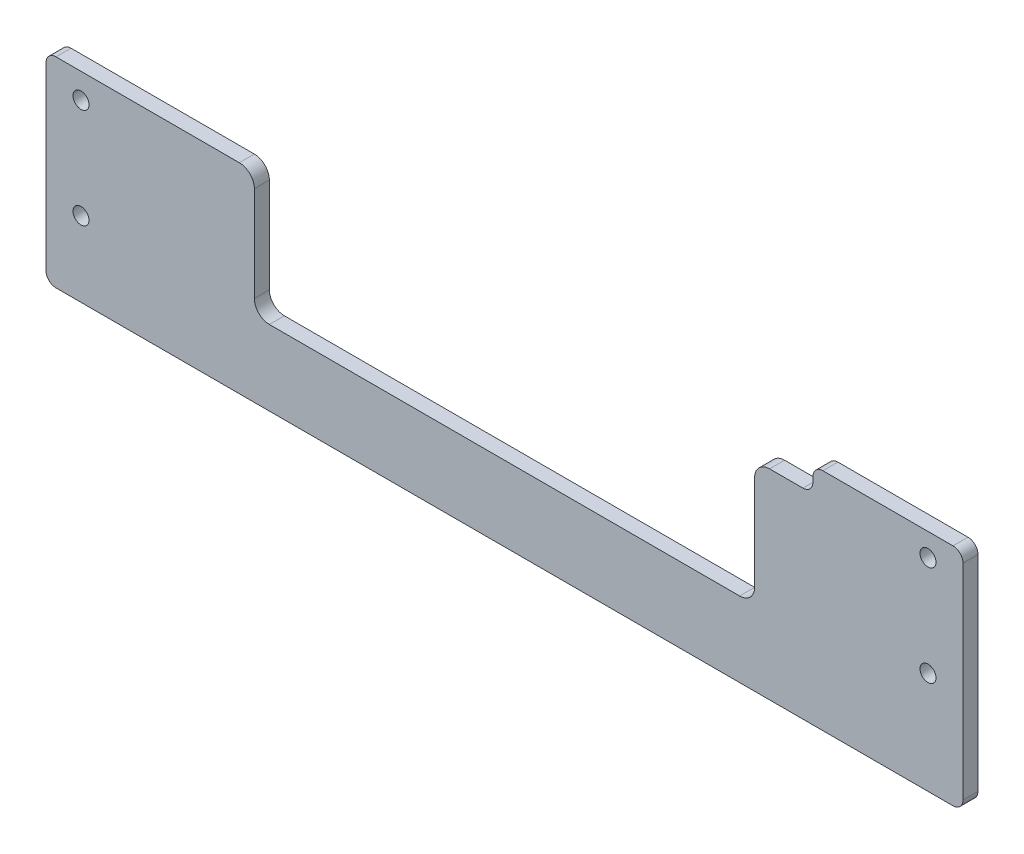
from build123d import *

# Parameters (mm, degrees)
EXTRUDE_1_DEPTH     = 3
FILLET_1_R          = 2
SKETCH_2_R          = 1.6
CUT_EXTRUDE_1_DEPTH = 14
SKETCH_3_W          = 100
SKETCH_3_H          = 25
CUT_EXTRUDE_2_DEPTH = 14
FILLET_2_R          = 3


with BuildPart() as part:
    # 草图1 → 凸台-拉伸1 (new body)
    with BuildSketch(Plane.XY):
        Polygon((0, 0), (183.3, 0), (183.3, 40), (183.3, 45), (153.3, 45), (153.3, 40), (0, 40), align=None)
    extrude(amount=EXTRUDE_1_DEPTH)

    # 圆角1
    fillet_1_edges = [part.edges().sort_by_distance(p)[0] for p in [
        (183.3, 0, 1.5),
        (0, 0, 1.5),
        (0, 40, 1.5),
        (183.3, 45, 1.5),
        (153.3, 45, 1.5),
        (153.3, 40, 1.5),
    ]]
    fillet(fillet_1_edges, radius=FILLET_1_R)

    # 草图2 → 切除-拉伸1 (cut)
    with BuildSketch(Plane(origin=(0, 0, 0), x_dir=(-1, 0, 0), z_dir=(0, 0, -1))):
        with Locations((-176.3, 40.44)):
            Circle(SKETCH_2_R)
        with Locations((-176.3, 20.44)):
            Circle(SKETCH_2_R)
        with Locations((-7, 35)):
            Circle(SKETCH_2_R)
        with Locations((-7, 15)):
            Circle(SKETCH_2_R)
    extrude(amount=-CUT_EXTRUDE_1_DEPTH, mode=Mode.SUBTRACT)

    # 草图3 → 切除-拉伸2 (cut)
    with BuildSketch(Plane(origin=(0, 0, 0), x_dir=(-1, 0, 0), z_dir=(0, 0, -1))):
        with Locations((-91.65, 27.5)):
            Rectangle(SKETCH_3_W, SKETCH_3_H)
    extrude(amount=-CUT_EXTRUDE_2_DEPTH, mode=Mode.SUBTRACT)

    # 圆角2
    fillet_2_edges = [part.edges().sort_by_distance(p)[0] for p in [
        (41.65, 40, 1.5),
        (41.65, 15, 1.5),
        (141.65, 15, 1.5),
        (141.65, 40, 1.5),
    ]]
    fillet(fillet_2_edges, radius=FILLET_2_R)


solid = part.part
